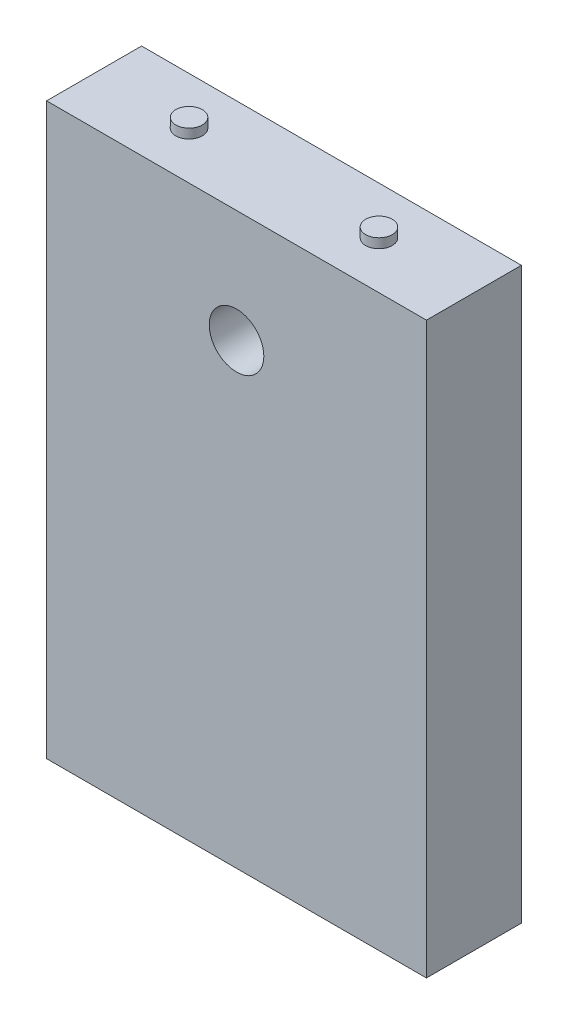
from build123d import *

# Parameters (mm, degrees)
SKETCH1_W           = 40
SKETCH1_H           = 60
SKETCH1_R           = 2.875
BOSS_EXTRUDE1_DEPTH = 10
SKETCH5_R           = 1.4
BOSS_EXTRUDE2_DEPTH = 1
BOSS_EXTRUDE3_START = 1
SKETCH6_R           = 1.4
BOSS_EXTRUDE3_DEPTH = 1


with BuildPart() as part:
    # Sketch1 → Boss-Extrude1 (new body)
    with BuildSketch(Plane.XY):
        with Locations((0, -1.385151574)):
            Rectangle(SKETCH1_W, SKETCH1_H)
        with Locations((0, 16.754848426)):
            Circle(SKETCH1_R, mode=Mode.SUBTRACT)
    extrude(amount=BOSS_EXTRUDE1_DEPTH)

    # Sketch5 → Boss-Extrude2 (add)
    with BuildSketch(Plane(origin=(0, 28.614848426, 0), x_dir=(1, 0, 0), z_dir=(0, 1, 0))):
        with Locations((-10, -5)):
            Circle(SKETCH5_R)
        with Locations((10, -5)):
            Circle(SKETCH5_R)
    extrude(amount=BOSS_EXTRUDE2_DEPTH)

    # Sketch6 → Boss-Extrude3 (add)
    with BuildSketch(Plane(origin=(0, -31.385151574, 0), x_dir=(-1, 0, 0), z_dir=(0, -1, 0)).offset(BOSS_EXTRUDE3_START)):
        with Locations((10, -5)):
            Circle(SKETCH6_R)
        with Locations((-10, -5)):
            Circle(SKETCH6_R)
    extrude(amount=-BOSS_EXTRUDE3_DEPTH)


solid = part.part
